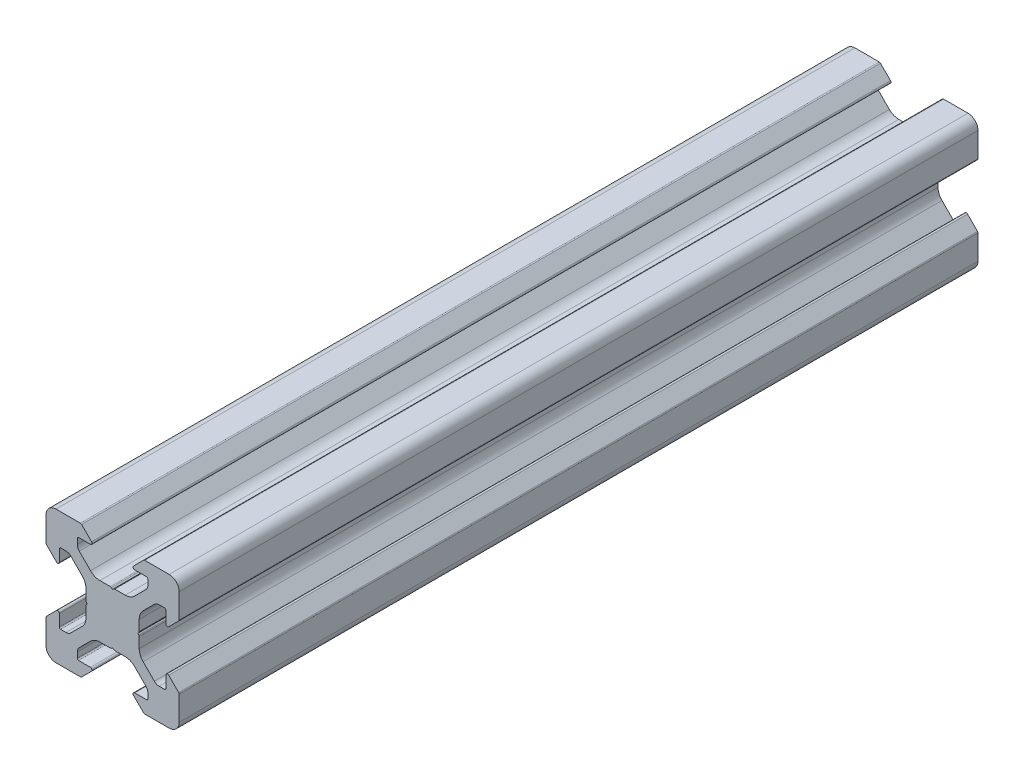
from build123d import *

# Parameters (mm, degrees)
EXTRUDE_1_DEPTH = 120


# Read off the part's stored shape, not the designer's step: 222 Конструкционный профиль 20х20-1-surface1
with BuildPart() as part:
    # Эскиз1 → Бобышка-Вытянуть1 (new body)
    with BuildSketch(Plane.XY):
        with BuildLine():
            Line((-3.945217202, 0.181521503), (-3.8, 0))
            Line((-3.8, 0), (-3.945217202, -0.181521503))
            ThreePointArc((-3.945217202, -0.181521503), (-3.98590708, -0.254943529), (-4, -0.337695265))
            Line((-4, -0.337695265), (-4, -1.898780669))
            ThreePointArc((-4, -1.898780669), (-4.152240935, -2.664147534), (-4.585786438, -3.312994231))
            Line((-4.585786438, -3.312994231), (-6.279898987, -5.007106781))
            ThreePointArc((-6.279898987, -5.007106781), (-6.604322336, -5.223879533), (-6.987005769, -5.3))
            Line((-6.987005769, -5.3), (-7.8, -5.3))
            ThreePointArc((-7.8, -5.3), (-7.941421356, -5.241421356), (-8, -5.1))
            Line((-8, -5.1), (-8, -3.33))
            ThreePointArc((-8, -3.33), (-8.154329142, -3.099030117), (-8.426776695, -3.153223305))
            Line((-8.426776695, -3.153223305), (-9.926776695, -4.653223305))
            ThreePointArc((-9.926776695, -4.653223305), (-9.980969883, -4.734329142), (-10, -4.83))
            Line((-10, -4.83), (-10, -8.5))
            ThreePointArc((-10, -8.5), (-9.560660172, -9.560660172), (-8.5, -10))
            Line((-8.5, -10), (-4.83, -10))
            ThreePointArc((-4.83, -10), (-4.734329142, -9.980969883), (-4.653223305, -9.926776695))
            Line((-4.653223305, -9.926776695), (-3.153223305, -8.426776695))
            ThreePointArc((-3.153223305, -8.426776695), (-3.099030117, -8.154329142), (-3.33, -8))
            Line((-3.33, -8), (-5.1, -8))
            ThreePointArc((-5.1, -8), (-5.241421356, -7.941421356), (-5.3, -7.8))
            Line((-5.3, -7.8), (-5.3, -6.987005769))
            ThreePointArc((-5.3, -6.987005769), (-5.223879533, -6.604322336), (-5.007106781, -6.279898987))
            Line((-5.007106781, -6.279898987), (-3.312994231, -4.585786438))
            ThreePointArc((-3.312994231, -4.585786438), (-2.664147534, -4.152240935), (-1.898780669, -4))
            Line((-1.898780669, -4), (-0.337695265, -4))
            ThreePointArc((-0.337695265, -4), (-0.254943529, -3.98590708), (-0.181521503, -3.945217202))
            Line((-0.181521503, -3.945217202), (0, -3.8))
            Line((0, -3.8), (0.181521503, -3.945217202))
            ThreePointArc((0.181521503, -3.945217202), (0.254943529, -3.98590708), (0.337695265, -4))
            Line((0.337695265, -4), (1.898780669, -4))
            ThreePointArc((1.898780669, -4), (2.664147534, -4.152240935), (3.312994231, -4.585786438))
            Line((3.312994231, -4.585786438), (5.007106781, -6.279898987))
            ThreePointArc((5.007106781, -6.279898987), (5.223879533, -6.604322336), (5.3, -6.987005769))
            Line((5.3, -6.987005769), (5.3, -7.8))
            ThreePointArc((5.3, -7.8), (5.241421356, -7.941421356), (5.1, -8))
            Line((5.1, -8), (3.33, -8))
            ThreePointArc((3.33, -8), (3.099030117, -8.154329142), (3.153223305, -8.426776695))
            Line((3.153223305, -8.426776695), (4.653223305, -9.926776695))
            ThreePointArc((4.653223305, -9.926776695), (4.734329142, -9.980969883), (4.83, -10))
            Line((4.83, -10), (8.5, -10))
            ThreePointArc((8.5, -10), (9.560660172, -9.560660172), (10, -8.5))
            Line((10, -8.5), (10, -4.83))
            ThreePointArc((10, -4.83), (9.980969883, -4.734329142), (9.926776695, -4.653223305))
            Line((9.926776695, -4.653223305), (8.426776695, -3.153223305))
            ThreePointArc((8.426776695, -3.153223305), (8.154329142, -3.099030117), (8, -3.33))
            Line((8, -3.33), (8, -5.1))
            ThreePointArc((8, -5.1), (7.941421356, -5.241421356), (7.8, -5.3))
            Line((7.8, -5.3), (6.987005769, -5.3))
            ThreePointArc((6.987005769, -5.3), (6.604322336, -5.223879533), (6.279898987, -5.007106781))
            Line((6.279898987, -5.007106781), (4.585786438, -3.312994231))
            ThreePointArc((4.585786438, -3.312994231), (4.152240935, -2.664147534), (4, -1.898780669))
            Line((4, -1.898780669), (4, -0.337695265))
            ThreePointArc((4, -0.337695265), (3.98590708, -0.254943529), (3.945217202, -0.181521503))
            Line((3.945217202, -0.181521503), (3.8, 0))
            Line((3.8, 0), (3.945217202, 0.181521503))
            ThreePointArc((3.945217202, 0.181521503), (3.98590708, 0.254943529), (4, 0.337695265))
            Line((4, 0.337695265), (4, 1.898780669))
            ThreePointArc((4, 1.898780669), (4.152240935, 2.664147534), (4.585786438, 3.312994231))
            Line((4.585786438, 3.312994231), (6.279898987, 5.007106781))
            ThreePointArc((6.279898987, 5.007106781), (6.604322336, 5.223879533), (6.987005769, 5.3))
            Line((6.987005769, 5.3), (7.8, 5.3))
            ThreePointArc((7.8, 5.3), (7.941421356, 5.241421356), (8, 5.1))
            Line((8, 5.1), (8, 3.33))
            ThreePointArc((8, 3.33), (8.154329142, 3.099030117), (8.426776695, 3.153223305))
            Line((8.426776695, 3.153223305), (9.926776695, 4.653223305))
            ThreePointArc((9.926776695, 4.653223305), (9.980969883, 4.734329142), (10, 4.83))
            Line((10, 4.83), (10, 8.5))
            ThreePointArc((10, 8.5), (9.560660172, 9.560660172), (8.5, 10))
            Line((8.5, 10), (4.83, 10))
            ThreePointArc((4.83, 10), (4.734329142, 9.980969883), (4.653223305, 9.926776695))
            Line((4.653223305, 9.926776695), (3.153223305, 8.426776695))
            ThreePointArc((3.153223305, 8.426776695), (3.099030117, 8.154329142), (3.33, 8))
            Line((3.33, 8), (5.1, 8))
            ThreePointArc((5.1, 8), (5.241421356, 7.941421356), (5.3, 7.8))
            Line((5.3, 7.8), (5.3, 6.987005769))
            ThreePointArc((5.3, 6.987005769), (5.223879533, 6.604322336), (5.007106781, 6.279898987))
            Line((5.007106781, 6.279898987), (3.312994231, 4.585786438))
            ThreePointArc((3.312994231, 4.585786438), (2.664147534, 4.152240935), (1.898780669, 4))
            Line((1.898780669, 4), (0.337695265, 4))
            ThreePointArc((0.337695265, 4), (0.254943529, 3.98590708), (0.181521503, 3.945217202))
            Line((0.181521503, 3.945217202), (0, 3.8))
            Line((0, 3.8), (-0.181521503, 3.945217202))
            ThreePointArc((-0.181521503, 3.945217202), (-0.254943529, 3.98590708), (-0.337695265, 4))
            Line((-0.337695265, 4), (-1.898780669, 4))
            ThreePointArc((-1.898780669, 4), (-2.664147534, 4.152240935), (-3.312994231, 4.585786438))
            Line((-3.312994231, 4.585786438), (-5.007106781, 6.279898987))
            ThreePointArc((-5.007106781, 6.279898987), (-5.223879533, 6.604322336), (-5.3, 6.987005769))
            Line((-5.3, 6.987005769), (-5.3, 7.8))
            ThreePointArc((-5.3, 7.8), (-5.241421356, 7.941421356), (-5.1, 8))
            Line((-5.1, 8), (-3.33, 8))
            ThreePointArc((-3.33, 8), (-3.099030117, 8.154329142), (-3.153223305, 8.426776695))
            Line((-3.153223305, 8.426776695), (-4.653223305, 9.926776695))
            ThreePointArc((-4.653223305, 9.926776695), (-4.734329142, 9.980969883), (-4.83, 10))
            Line((-4.83, 10), (-8.5, 10))
            ThreePointArc((-8.5, 10), (-9.560660172, 9.560660172), (-10, 8.5))
            Line((-10, 8.5), (-10, 4.83))
            ThreePointArc((-10, 4.83), (-9.980969883, 4.734329142), (-9.926776695, 4.653223305))
            Line((-9.926776695, 4.653223305), (-8.426776695, 3.153223305))
            ThreePointArc((-8.426776695, 3.153223305), (-8.154329142, 3.099030117), (-8, 3.33))
            Line((-8, 3.33), (-8, 5.1))
            ThreePointArc((-8, 5.1), (-7.941421356, 5.241421356), (-7.8, 5.3))
            Line((-7.8, 5.3), (-6.987005769, 5.3))
            ThreePointArc((-6.987005769, 5.3), (-6.604322336, 5.223879533), (-6.279898987, 5.007106781))
            Line((-6.279898987, 5.007106781), (-4.585786438, 3.312994231))
            ThreePointArc((-4.585786438, 3.312994231), (-4.152240935, 2.664147534), (-4, 1.898780669))
            Line((-4, 1.898780669), (-4, 0.337695265))
            ThreePointArc((-4, 0.337695265), (-3.98590708, 0.254943529), (-3.945217202, 0.181521503))
        make_face()
    extrude(amount=EXTRUDE_1_DEPTH)


solid = part.part
